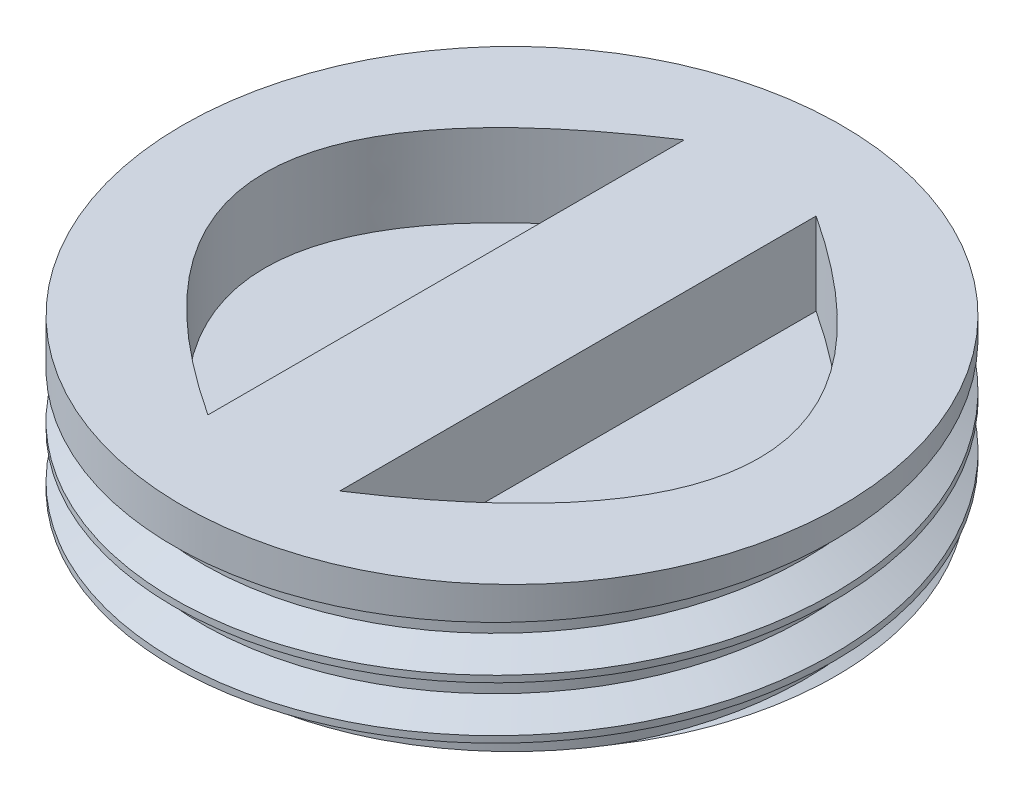
from build123d import *

# Parameters (mm, degrees)
SKETCH1_R           = 20
BOSS_EXTRUDE1_DEPTH = 10
THREAD1_PITCH       = 3.175
CUT_EXTRUDE2_DEPTH  = 5


with BuildPart() as part:
    # Sketch1 → Boss-Extrude1 (new body)
    with BuildSketch(Plane(origin=(0, 0, 0), x_dir=(1, 0, 0), z_dir=(0, 1, 0))):
        with Locations(Location((-62.417227704, 31.446847546, 0), (0, 0, 270))):
            Circle(SKETCH1_R)
    extrude(amount=BOSS_EXTRUDE1_DEPTH)

    # Thread1: the profile of Thread Profile1 profile screwed along a right-hand helix of 3.149606 turns, 12 arcs to a turn; built about Z, then put on its axis
    thread1_z = Axis((0, 0, 0), (0, 0, 1))
    thread1_corners = [(20.0003, 0, -0.000173205), (20.0003, 0, 2.778298196), (18.281480847, 0, 1.785937496), (18.281480847, 0, 0.992187496)]
    with BuildLine(mode=Mode.PRIVATE) as thread1_profile:
        Line(thread1_corners[0], thread1_corners[1])
        Line(thread1_corners[1], thread1_corners[2])
        Line(thread1_corners[2], thread1_corners[3])
        Line(thread1_corners[3], thread1_corners[0])
    thread1_cap = Face(thread1_profile.wire())
    thread1_turn_angles = [0, 15, 30, 45, 60, 75, 90, 105, 120, 135, 150, 165, 180, 195, 210, 225, 240, 255, 270, 285, 300, 315, 330, 345, 360]
    thread1_turn_weights = [1, 0.9659258262890683, 1, 0.9659258262890683, 1, 0.9659258262890683, 1, 0.9659258262890683, 1, 0.9659258262890683, 1, 0.9659258262890683, 1, 0.9659258262890683, 1, 0.9659258262890683, 1, 0.9659258262890683, 1, 0.9659258262890683, 1, 0.9659258262890683, 1, 0.9659258262890683, 1]
    thread1_turn_rails = [Edge.make_bspline([Vector(p[0], p[1], 0).rotate(thread1_z, thread1_turn_angles[k]) / thread1_turn_weights[k] + Vector(0, 0, p[2] + THREAD1_PITCH * thread1_turn_angles[k] / 360) for k in range(25)], [0, 0, 0, 1, 1, 2, 2, 3, 3, 4, 4, 5, 5, 6, 6, 7, 7, 8, 8, 9, 9, 10, 10, 11, 11, 12, 12, 12], 2, thread1_turn_weights) for p in thread1_corners]
    thread1_turn_sides = [Face.make_surface_from_curves(thread1_turn_rails[p[0]], thread1_turn_rails[p[1]]) for p in [(0, 1), (1, 2), (2, 3), (3, 0)]]
    thread1_last_angles = [1080, 1095, 1110, 1121.929133858, 1133.858267717]
    thread1_last_weights = [1, 0.9659258262890683, 1, 0.9784040075425771, 1]
    thread1_last_rails = [Edge.make_bspline([Vector(p[0], p[1], 0).rotate(thread1_z, thread1_last_angles[k]) / thread1_last_weights[k] + Vector(0, 0, p[2] + THREAD1_PITCH * thread1_last_angles[k] / 360) for k in range(5)], [0, 0, 0, 1, 1, 2, 2, 2], 2, thread1_last_weights) for p in thread1_corners]
    thread1_last_sides = [Face.make_surface_from_curves(thread1_last_rails[p[0]], thread1_last_rails[p[1]]) for p in [(0, 1), (1, 2), (2, 3), (3, 0)]]
    thread1 = Plane(origin=(-62.417227704, 10, -31.446847546), x_dir=(-1, 0, 0), z_dir=(0, -1, 0)) * Solid(Shell([*[p.moved(Location((0, 0, THREAD1_PITCH * i))) for i in range(3) for p in thread1_turn_sides], *thread1_last_sides, thread1_cap, thread1_cap.rotate(thread1_z, 1133.858267717).moved(Location((0, 0, THREAD1_PITCH * 1133.858267717 / 360)))]))
    add(thread1, mode=Mode.SUBTRACT)

    # Sketch9 → Cut-Extrude2 (cut)
    with BuildSketch(Plane(origin=(0, 10, 0), x_dir=(1, 0, 0), z_dir=(0, 1, 0))):
        with BuildLine():
            Line((-66.417227704, 45.90367984), (-66.417227704, 31.446847546))
            Line((-66.417227704, 31.446847546), (-66.417227704, 16.990015251))
            add(Edge.make_bspline(
                [(-66.417227704, 45.90367984), (-88.417227704, 31.446847546), (-66.417227704, 16.990015251)],
                knots=[0, 0, 0, 1, 1, 1], degree=2))
        make_face()
        with BuildLine():
            Line((-58.417227704, 45.90367984), (-58.417227704, 16.990015251))
            add(Edge.make_bspline(
                [(-58.417227704, 45.90367984), (-36.417227704, 31.446847546), (-58.417227704, 16.990015251)],
                knots=[0, 0, 0, 1, 1, 1], degree=2))
        make_face()
    extrude(amount=-CUT_EXTRUDE2_DEPTH, mode=Mode.SUBTRACT)


solid = part.part
